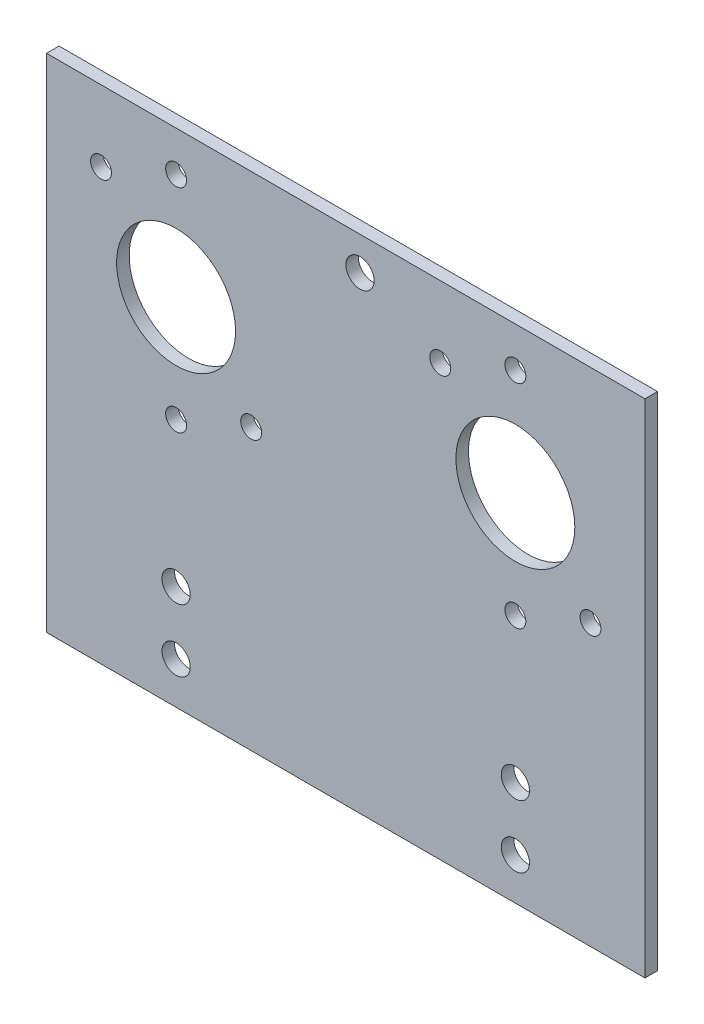
from build123d import *

# Parameters (mm, degrees)
SKETCH1_W           = 143.16
SKETCH1_H           = 120
BOSS_EXTRUDE1_DEPTH = 3
SKETCH2_R           = 14.225
SKETCH2_R_2         = 3.375
CUT_EXTRUDE1_DEPTH  = 187.825548574
SKETCH3_R           = 2.0193
CUT_EXTRUDE2_DEPTH  = 187.825548574
SKETCH6_R           = 2.5
CUT_EXTRUDE3_DEPTH  = 187.825548574


with BuildPart() as part:
    # Sketch1 → Boss-Extrude1 (new body)
    with BuildSketch(Plane.XY):
        with Locations((71.58, -60)):
            Rectangle(SKETCH1_W, SKETCH1_H)
    extrude(amount=BOSS_EXTRUDE1_DEPTH)

    # Sketch2 → Cut-Extrude1 (cut, through all)
    with BuildSketch(Plane.XY.offset(3)):
        with Locations((31, -35)):
            Circle(SKETCH2_R)
        with Locations((112.16, -35)):
            Circle(SKETCH2_R)
        with Locations((31, -110)):
            Circle(SKETCH2_R_2)
        with Locations((112.16, -110)):
            Circle(SKETCH2_R_2)
        with Locations((75, -8)):
            Circle(SKETCH2_R_2)
        with Locations((31, -95)):
            Circle(SKETCH2_R_2)
        with Locations((112.16, -95)):
            Circle(SKETCH2_R_2)
    extrude(amount=-CUT_EXTRUDE1_DEPTH, mode=Mode.SUBTRACT)

    # Sketch3 → Cut-Extrude2 (cut, through all)
    with BuildSketch(Plane(origin=(0, 0, 0), x_dir=(-1, 0, 0), z_dir=(0, 0, -1))):
        with Locations((-48.960512242, -52.960512242)):
            Circle(SKETCH3_R)
        with Locations((-31, -9.6)):
            Circle(SKETCH3_R)
        with Locations((-13.039487758, -17.039487758)):
            Circle(SKETCH3_R)
        with Locations((-31, -60.4)):
            Circle(SKETCH3_R)
        with Locations((-94.199487758, -17.039487758)):
            Circle(SKETCH3_R)
        with Locations((-112.16, -9.6)):
            Circle(SKETCH3_R)
        with Locations((-112.16, -60.4)):
            Circle(SKETCH3_R)
        with Locations((-130.120512242, -52.960512242)):
            Circle(SKETCH3_R)
    extrude(amount=-CUT_EXTRUDE2_DEPTH, mode=Mode.SUBTRACT)

    # Sketch6 → Cut-Extrude3 (cut, through all)
    with BuildSketch(Plane.XY.offset(3)):
        with Locations((31, -60.4)):
            Circle(SKETCH6_R)
        with Locations((48.960512242, -52.960512242)):
            Circle(SKETCH6_R)
        with Locations((31, -9.6)):
            Circle(SKETCH6_R)
        with Locations((13.039487758, -17.039487758)):
            Circle(SKETCH6_R)
        with Locations((130.120512242, -52.960512242)):
            Circle(SKETCH6_R)
        with Locations((112.16, -60.4)):
            Circle(SKETCH6_R)
        with Locations((94.199487758, -17.039487758)):
            Circle(SKETCH6_R)
        with Locations((112.16, -9.6)):
            Circle(SKETCH6_R)
    extrude(amount=-CUT_EXTRUDE3_DEPTH, mode=Mode.SUBTRACT)


solid = part.part
